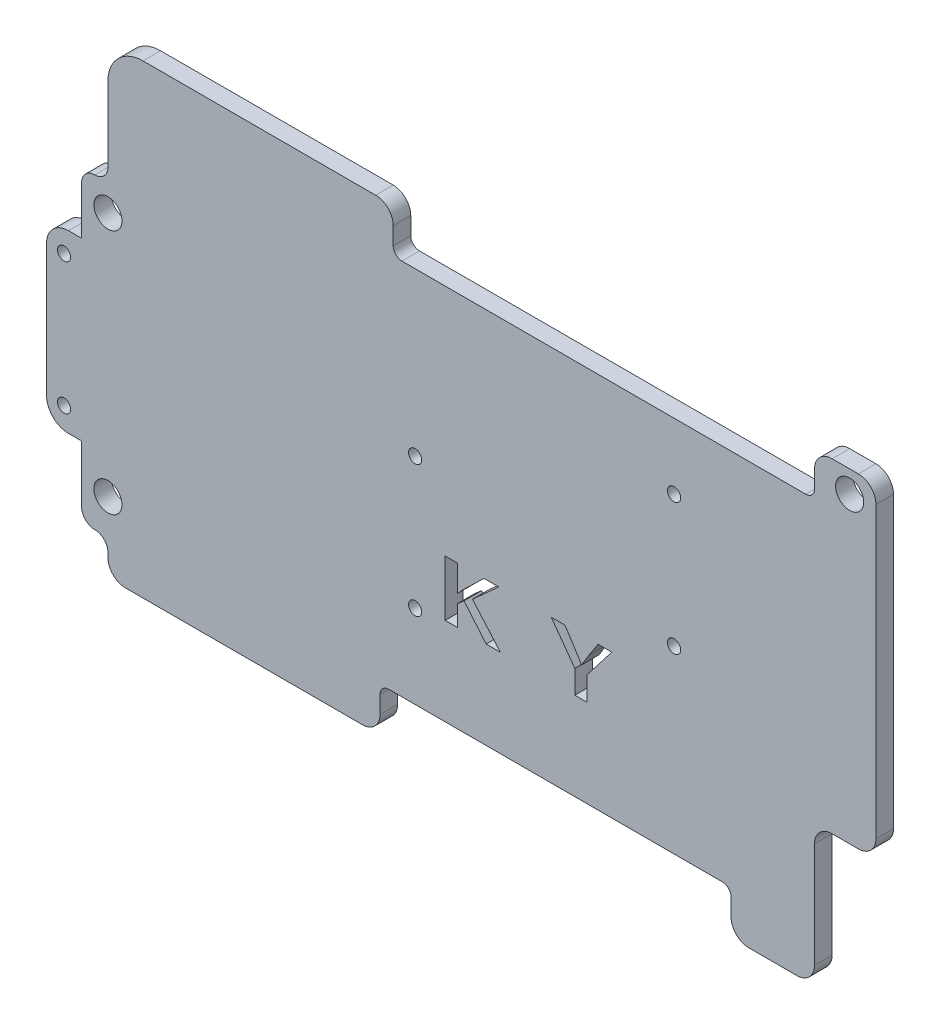
from build123d import *

# Parameters (mm, degrees)
SKETCH_6_W          = 94.5
SKETCH_6_H          = 55
EXTRUDE_1_DEPTH     = 2
SKETCH_772_W        = 40
SKETCH_772_H        = 6
SKETCH_772_W_2      = 48
CUT_EXTRUDE_1_DEPTH = 75.571373034
JOY_R               = 1.6
CUT_EXTRUDE_2_DEPTH = 75.571373034
NANO_R              = 0.75
CUT_EXTRUDE_4_DEPTH = 75.571373034
SKETCH_648_R        = 0.75
CUT_EXTRUDE_5_DEPTH = 75.571373034
SKETCH_7_W          = 7
SKETCH_7_H          = 17
SKETCH_7_W_2        = 4
SKETCH_7_H_2        = 22
CUT_EXTRUDE_6_DEPTH = 75.571373034
CUT_EXTRUDE_7_DEPTH = 75.571373034
SKETCH_10_W         = 90.5
SKETCH_10_H         = 1
SKETCH_10_W_2       = 80.5
CUT_EXTRUDE_8_DEPTH = 75.571373175
FILLET_3_R          = 1
FILLET_START        = -1
FILLET_4_DEPTH      = 4
FILLET_4_2_DEPTH    = 2
FILLET_5_R          = 2
FILLET_6_R          = 2.5
SKETCH_11_W         = 3
SKETCH_11_H         = 14
CUT_EXTRUDE_9_DEPTH = 75.027756944
FILLET_7_R          = 1.5
FILLET_8_R          = 4


with BuildPart() as part:
    # 草图6 → 凸台-拉伸1 (new body)
    with BuildSketch(Plane.XY):
        with Locations((15.078651685, 13.390449438)):
            Rectangle(SKETCH_6_W, SKETCH_6_H)
    extrude(amount=EXTRUDE_1_DEPTH)

    # Sketch 772 → 切除-拉伸1 (cut, through all)
    with BuildSketch(Plane.XY):
        with Locations((25.828651685, -11.109550562)):
            Rectangle(SKETCH_772_W, SKETCH_772_H)
        with Locations((31.328651685, 37.890449438)):
            Rectangle(SKETCH_772_W_2, SKETCH_772_H)
    extrude(amount=CUT_EXTRUDE_1_DEPTH, mode=Mode.SUBTRACT)

    # Joy → 切除-拉伸2 (cut, through all)
    with BuildSketch(Plane.XY):
        with Locations((-25.171348315, 22.890449438)):
            Circle(JOY_R)
        with Locations((59.328651685, 37.390449438)):
            Circle(JOY_R)
        with Locations((-25.171348315, -5.109550562)):
            Circle(JOY_R)
    extrude(amount=CUT_EXTRUDE_2_DEPTH, mode=Mode.SUBTRACT)

    # Nano → 切除-拉伸4 (cut, through all)
    with BuildSketch(Plane.XY):
        with Locations((-30.171348315, 16.390449438)):
            Circle(NANO_R)
        with Locations((9.828651685, 1.390449438)):
            Circle(NANO_R)
        with Locations((-30.171348315, 1.390449438)):
            Circle(NANO_R)
        with Locations((9.828651685, 16.390449438)):
            Circle(NANO_R)
    extrude(amount=CUT_EXTRUDE_4_DEPTH, mode=Mode.SUBTRACT)

    # Sketch 648 → 切除-拉伸5 (cut, through all)
    with BuildSketch(Plane.XY):
        with Locations((39.328651685, 12.390449438)):
            Circle(SKETCH_648_R)
        with Locations((39.328651685, 27.390449438)):
            Circle(SKETCH_648_R)
    extrude(amount=CUT_EXTRUDE_5_DEPTH, mode=Mode.SUBTRACT)

    # 草图7 → 切除-拉伸6 (cut, through all)
    with BuildSketch(Plane.XY.offset(2)):
        with Locations((58.828651685, -5.609550562)):
            Rectangle(SKETCH_7_W, SKETCH_7_H)
        Polygon((-32.171348315, -14.109550562), (-25.171348315, -14.109550562), (-25.171348315, -9.109550562), (-28.171348315, -9.109550562), (-28.171348315, -1.109550562), (-32.171348315, -1.109550562), (-32.171348315, -10.609550562), align=None)
        with Locations((-30.171348315, 29.890449438)):
            Rectangle(SKETCH_7_W_2, SKETCH_7_H_2)
    extrude(amount=-CUT_EXTRUDE_6_DEPTH, mode=Mode.SUBTRACT)

    # 草图9 → 切除-拉伸7 (cut, through all)
    with BuildSketch(Plane.XY.offset(2)):
        with BuildLine():
            Line((16.358384135, 5.546605741), (19.354312374, 8.252448685))
            Line((19.354312374, 8.252448685), (17.671340733, 8.252448685))
            Line((17.671340733, 8.252448685), (15.319954825, 5.97825988))
            add(Edge.make_bspline(
                [(15.319954825, 5.97825988), (15.209662045, 5.864263234), (14.985948929, 5.633037354), (14.771319897, 5.3933541), (14.662505102, 5.271837061)],
                knots=[0, 0, 0, 0, 0.986019789, 2, 2, 2, 2], degree=3))
            Line((14.662505102, 5.271837061), (14.627668618, 5.272671384))
            Line((14.627668618, 5.272671384), (14.627668618, 8.252448685))
            Line((14.627668618, 8.252448685), (13.255032174, 8.252448685))
            Line((13.255032174, 8.252448685), (13.255032174, 1.902448685))
            Line((13.255032174, 1.902448685), (14.627668618, 1.902448685))
            Line((14.627668618, 1.902448685), (14.627668618, 4.235041243))
            Line((14.627668618, 4.235041243), (15.391570639, 4.899124533))
            Line((15.391570639, 4.899124533), (17.921996084, 1.902448685))
            Line((17.921996084, 1.902448685), (19.53335191, 1.902448685))
            Line((19.53335191, 1.902448685), (16.358384135, 5.546605741))
        make_face()
        with BuildLine():
            Line((30.672569626, 8.252448685), (29.58639644, 6.600837965))
            add(Edge.make_bspline(
                [(29.58639644, 6.600837965), (29.512770867, 6.486048967), (29.368664533, 6.261374021), (29.16262961, 5.926527835), (28.970896691, 5.601336831), (28.850642197, 5.385664551), (28.791857671, 5.280236534)],
                knots=[0, 0, 0, 0, 1.061571746, 2.077799947, 3.060362604, 4, 4, 4, 4], degree=3))
            Line((28.791857671, 5.280236534), (28.76821775, 5.280972425))
            add(Edge.make_bspline(
                [(28.76821775, 5.280972425), (28.708109277, 5.390783537), (28.58821426, 5.609817636), (28.392410779, 5.93256056), (28.188467145, 6.25994594), (28.046996459, 6.479545222), (27.974708994, 6.591754161)],
                knots=[0, 0, 0, 0, 0.980022492, 1.954796193, 2.954959484, 4, 4, 4, 4], degree=3))
            Line((27.974708994, 6.591754161), (26.900724886, 8.252448685))
            Line((26.900724886, 8.252448685), (25.337112937, 8.252448685))
            Line((25.337112937, 8.252448685), (28.02270598, 4.558781847))
            Line((28.02270598, 4.558781847), (28.02270598, 1.902448685))
            Line((28.02270598, 1.902448685), (29.395420935, 1.902448685))
            Line((29.395420935, 1.902448685), (29.395420935, 4.58368497))
            Line((29.395420935, 4.58368497), (32.224245607, 8.252448685))
            Line((32.224245607, 8.252448685), (30.672569626, 8.252448685))
        make_face()
    extrude(amount=-CUT_EXTRUDE_7_DEPTH, mode=Mode.SUBTRACT)

    # 草图10 → 切除-拉伸8 (cut, through all)
    with BuildSketch(Plane.XY.offset(2)):
        with Locations((17.078651685, 40.390449438)):
            Rectangle(SKETCH_10_W, SKETCH_10_H)
        with Locations((15.078651685, -13.609550562)):
            Rectangle(SKETCH_10_W_2, SKETCH_10_H)
    extrude(amount=-CUT_EXTRUDE_8_DEPTH, mode=Mode.SUBTRACT)

    # 圆角3
    fillet_3_edges = [part.edges().sort_by_distance(p)[0] for p in [
        (45.828651685, -8.109550562, 1),
        (5.828651685, -8.109550562, 1),
        (55.328651685, 34.890449438, 1),
        (7.328651685, 34.890449438, 1),
    ]]
    fillet(fillet_3_edges, radius=FILLET_3_R)

    # 圆角4: read off the stored shape, not the designer's step
    # 圆角4 outline → 圆角4 (cut)
    with BuildSketch(Plane.XY.offset(FILLET_START)):
        with BuildLine():
            ThreePointArc((-26.671348315, -9.109550562), (-27.732008486, -8.670210734), (-28.171348315, -7.609550562))
            Line((-28.171348315, -7.609550562), (-28.171348315, -9.109550562))
            Line((-28.171348315, -9.109550562), (-26.671348315, -9.109550562))
        make_face()
    extrude(amount=FILLET_4_DEPTH, mode=Mode.SUBTRACT)

    # Fillet 4 2 outline → Fillet 4 2 (add)
    with BuildSketch(Plane.XY):
        with BuildLine():
            Line((-25.171348315, -9.109550562), (-26.671348315, -9.109550562))
            ThreePointArc((-26.671348315, -9.109550562), (-25.610688143, -9.54889039), (-25.171348315, -10.609550562))
            Line((-25.171348315, -10.609550562), (-25.171348315, -9.109550562))
        make_face()
    extrude(amount=FILLET_4_2_DEPTH)

    # 圆角5
    fillet_5_edges = [part.edges().sort_by_distance(p)[0] for p in [
        (55.328651685, 2.890449438, 1),
        (55.328651685, 39.890449438, 1),
        (7.328651685, 39.890449438, 1),
        (62.328651685, 39.890449438, 1),
        (45.828651685, -13.109550562, 1),
        (5.828651685, -13.109550562, 1),
        (-25.171348315, -13.109550562, 1),
        (55.328651685, -13.109550562, 1),
        (62.328651685, 2.890449438, 1),
    ]]
    fillet(fillet_5_edges, radius=FILLET_5_R)

    # 圆角6
    fillet_6_edges = [part.edges().sort_by_distance(p)[0] for p in [
        (-32.171348315, -1.109550562, 1),
        (-32.171348315, 18.890449438, 1),
    ]]
    fillet(fillet_6_edges, radius=FILLET_6_R)

    # 草图11 → 切除-拉伸9 (cut, through all)
    with BuildSketch(Plane(origin=(0, 0, 0), x_dir=(-1, 0, 0), z_dir=(0, 0, -1))):
        with Locations((26.671348315, 32.890449438)):
            Rectangle(SKETCH_11_W, SKETCH_11_H)
    extrude(amount=-CUT_EXTRUDE_9_DEPTH, mode=Mode.SUBTRACT)

    # 圆角7
    # the kernel refuses this fillet: 1.5 mm, written as the material it adds along each edge
    with BuildSketch(Plane(origin=(-25.171348315, 25.890449438, 0), x_dir=(0, 1, 0), z_dir=(0, 0, 1))) as fillet_7_piece_1:
        with BuildLine():
            CenterArc((FILLET_7_R, FILLET_7_R), FILLET_7_R, 180, 90)
            Line((0, FILLET_7_R), (0, 0))
            Line((0, 0), (FILLET_7_R, 0))
        make_face()
    extrude(amount=2)
    # the kernel refuses this fillet: 1.5 mm, written as the material it takes off along each edge
    with BuildSketch(Plane(origin=(-28.171348315, 25.890449438, -3.75), x_dir=(1, 0, 0), z_dir=(0, 0, 1))) as fillet_7_2_piece_1:
        with BuildLine():
            CenterArc((FILLET_7_R, -FILLET_7_R), FILLET_7_R, 90, 90)
            Line((0, -FILLET_7_R), (0, 0))
            Line((0, 0), (FILLET_7_R, 0))
        make_face()
    extrude(amount=9.5, mode=Mode.SUBTRACT)

    # 圆角8
    fillet_8_edges = [part.edges().sort_by_distance(p)[0] for p in [
        (-25.171348315, 39.890449438, 1),
    ]]
    fillet(fillet_8_edges, radius=FILLET_8_R)


solid = part.part
